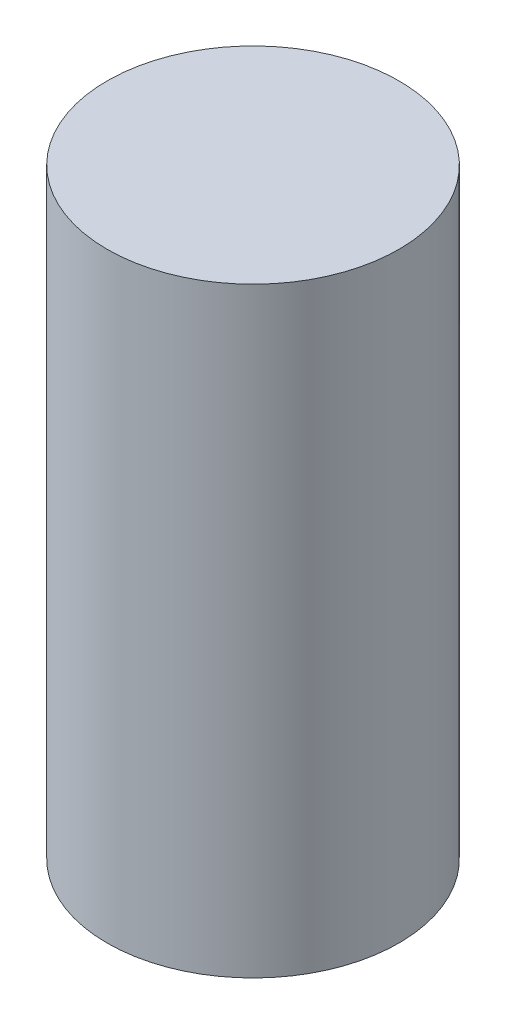
from build123d import *

# Parameters (mm, degrees)
SKETCH1_R           = 34
BOSS_EXTRUDE1_DEPTH = 140


with BuildPart() as part:
    # Sketch1 → Boss-Extrude1 (new body)
    with BuildSketch(Plane(origin=(0, 0, 0), x_dir=(1, 0, 0), z_dir=(0, 1, 0))):
        Circle(SKETCH1_R)
    extrude(amount=BOSS_EXTRUDE1_DEPTH)


solid = part.part
